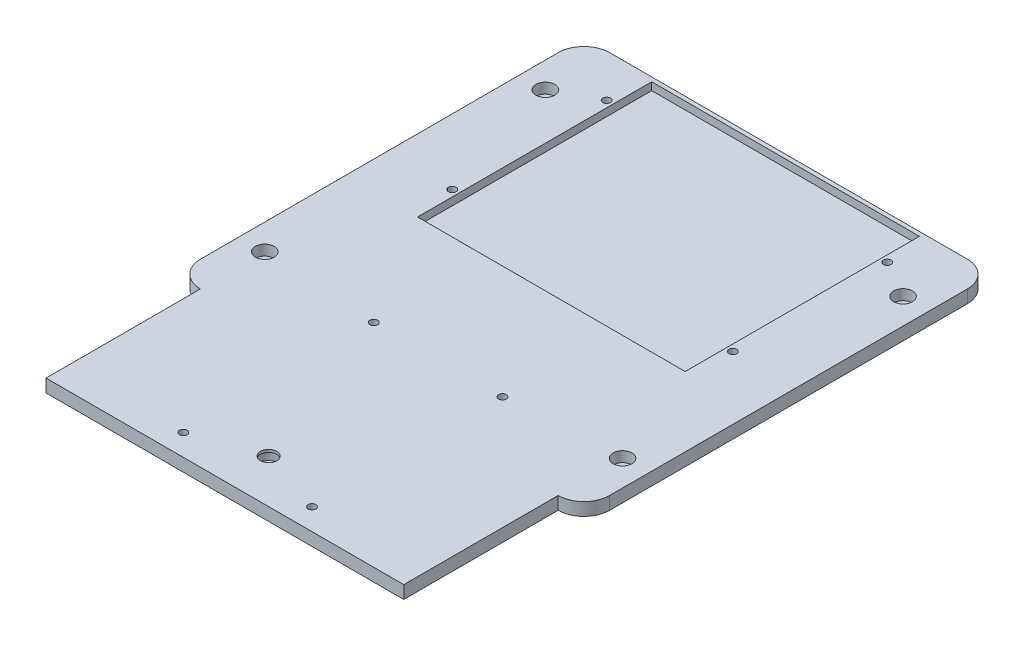
from build123d import *
from build123d.topology import SkipClean

# Parameters (mm, degrees)
SKETCH_1_W               = 159
SKETCH_1_H               = 159
EXTRUDE_1_DEPTH          = 5
SKETCH_2_R               = 2
CUT_EXTRUDE_1_DEPTH      = 5.1
SKETCH_3_R               = 3.65
CUT_EXTRUDE_2_DEPTH      = 4.05
EXTRUDE_3_DEPTH          = 60
SKETCH_6_R               = 3.175
CUT_EXTRUDE_3_DEPTH      = 60
SKETCH_7_R               = 4.9
CUT_EXTRUDE_4_DEPTH      = 4
SKETCH_8_W               = 110.4
SKETCH_8_H               = 88.4
CUT_EXTRUDE_5_DEPTH      = 3
SKETCH_9_R               = 1.5
CUT_EXTRUDE_6_DEPTH      = 10
FILLET_1_R               = 10
FILLET_2_R               = 10
FILLET_3_R               = 10
FILLET_4_R               = 10
SKETCH_11_W              = 49.5
SKETCH_11_H              = 5
EXTRUDE_4_DEPTH          = 60
SKETCH_12_W              = 49.5
SKETCH_12_H              = 5
EXTRUDE_5_DEPTH          = 60
SKETCH_13_R              = 1.5
CUT_EXTRUDE_7_DEPTH      = 5
SKETCH_14_R              = 3
CUT_EXTRUDE_8_DEPTH      = 2.5
SKETCH_16_R              = 1.5
EXTRUDE_6_DEPTH          = 0.5
SKETCH_16_R_2            = 1.448084079
EXTRUDE_6_2_DEPTH        = 0.5
EXTRUDE_6_3_DEPTH        = 0.5
EXTRUDE_6_4_DEPTH        = 0.5
SKETCH_18_W              = 110.4
SKETCH_18_H              = 88.4
EXTRUDE_7_DEPTH          = 3
SKETCH_18_2_W            = 110.4
SKETCH_18_2_H            = 88.4
EXTRUDE_8_DEPTH          = 2
SKETCH_22_W              = 104
SKETCH_22_H              = 91
CUT_EXTRUDE_10_DEPTH     = 3
SKETCH_23_R              = 1.5
CUT_EXTRUDE_11_DEPTH     = 2
CUT_EXTRUDE_12_OUTLINE_R = 1.5
CUT_EXTRUDE_12_DEPTH     = 3


# Read off the part's stored shape, not the designer's step: 切除-拉伸12
with BuildPart() as part:
    # 草图1 → 凸台-拉伸1 (new body)
    with BuildSketch(Plane(origin=(0, 0, 0), x_dir=(1, 0, 0), z_dir=(0, 1, 0))):
        with Locations((-0.471002014, -22.874671738)):
            Rectangle(SKETCH_1_W, SKETCH_1_H)
    extrude(amount=EXTRUDE_1_DEPTH)

    # 草图2 → 切除-拉伸1 (cut)
    with BuildSketch(Plane(origin=(0, 5, 0), x_dir=(1, 0, 0), z_dir=(0, 1, 0))):
        with Locations(Location((-69.971002014, -77.374671738, 0), (0, 0, 270))):
            Circle(SKETCH_2_R)
        with Locations(Location((-69.971002014, 31.625328262, 0), (0, 0, 270))):
            Circle(SKETCH_2_R)
        with Locations(Location((69.028997986, -77.374671738, 0), (0, 0, 270))):
            Circle(SKETCH_2_R)
        with Locations(Location((69.028997986, 31.625328262, 0), (0, 0, 270))):
            Circle(SKETCH_2_R)
    extrude(amount=-CUT_EXTRUDE_1_DEPTH, mode=Mode.SUBTRACT)

    # 草图3 → 切除-拉伸2 (cut)
    with BuildSketch(Plane(origin=(0, 5, 0), x_dir=(1, 0, 0), z_dir=(0, 1, 0))):
        with Locations(Location((-69.971002014, -77.374671738, 0), (0, 0, 270))):
            Circle(SKETCH_3_R)
        with Locations(Location((69.028997986, -77.374671738, 0), (0, 0, 270))):
            Circle(SKETCH_3_R)
        with Locations(Location((69.028997986, 31.625328262, 0), (0, 0, 270))):
            Circle(SKETCH_3_R)
        with Locations(Location((-69.971002014, 31.625328262, 0), (0, 0, 270))):
            Circle(SKETCH_3_R)
    extrude(amount=-CUT_EXTRUDE_2_DEPTH, mode=Mode.SUBTRACT)

    # 草图4 → 凸台-拉伸3 (add)
    with BuildSketch(Plane.XY.offset(102.374671738)):
        Polygon((19.528997986, 5), (-0.471002014, 5), (-20.471002014, 5), (-20.471002014, 0), (19.528997986, 0), align=None)
    extrude(amount=EXTRUDE_3_DEPTH)

    # 草图6 → 切除-拉伸3 (cut)
    with BuildSketch(Plane.XZ):
        with Locations(Location((-0.471002014, 145.374671738, 0), (0, 0, 270))):
            Circle(SKETCH_6_R)
    extrude(amount=-CUT_EXTRUDE_3_DEPTH, mode=Mode.SUBTRACT)

    # 草图7 → 切除-拉伸4 (cut)
    with BuildSketch(Plane(origin=(0, 0, 0), x_dir=(-1, 0, 0), z_dir=(0, -1, 0))):
        with Locations(Location((0.471002014, -145.374671738, 0), (0, 0, 90))):
            Circle(SKETCH_7_R)
    extrude(amount=-CUT_EXTRUDE_4_DEPTH, mode=Mode.SUBTRACT)

    # 草图8 → 切除-拉伸5 (cut)
    with BuildSketch(Plane(origin=(0, 5, 0), x_dir=(1, 0, 0), z_dir=(0, 1, 0))):
        with Locations((-0.471002014, 10.625328262)):
            Rectangle(SKETCH_8_W, SKETCH_8_H)
    extrude(amount=-CUT_EXTRUDE_5_DEPTH, mode=Mode.SUBTRACT)

    # 草图9 → 切除-拉伸6 (cut)
    with BuildSketch(Plane(origin=(0, 2, 0), x_dir=(1, 0, 0), z_dir=(0, 1, 0))):
        with Locations(Location((52.028997986, 52.125328262, 0), (0, 0, 270))):
            Circle(SKETCH_9_R)
        with Locations(Location((52.028997986, -30.874671738, 0), (0, 0, 270))):
            Circle(SKETCH_9_R)
        with Locations(Location((-52.971002014, -30.874671738, 0), (0, 0, 270))):
            Circle(SKETCH_9_R)
        with Locations(Location((-52.971002014, 52.125328262, 0), (0, 0, 270))):
            Circle(SKETCH_9_R)
    extrude(amount=-CUT_EXTRUDE_6_DEPTH, mode=Mode.SUBTRACT)

    # 圆角1
    fillet_1_edges = [part.edges().sort_by_distance(p)[0] for p in [
        (79.028997986, 2.5, -56.625328262),
    ]]
    fillet(fillet_1_edges, radius=FILLET_1_R)

    # 圆角2
    fillet_2_edges = [part.edges().sort_by_distance(p)[0] for p in [
        (-79.971002014, 2.5, -56.625328262),
    ]]
    fillet(fillet_2_edges, radius=FILLET_2_R)

    # 圆角3
    fillet_3_edges = [part.edges().sort_by_distance(p)[0] for p in [
        (-79.971002014, 2.5, 102.374671738),
    ]]
    fillet(fillet_3_edges, radius=FILLET_3_R)

    # 圆角4
    fillet_4_edges = [part.edges().sort_by_distance(p)[0] for p in [
        (79.028997986, 2.5, 102.374671738),
    ]]
    fillet(fillet_4_edges, radius=FILLET_4_R)

    # 草图11 → 凸台-拉伸4 (add)
    with BuildSketch(Plane.XY.offset(102.374671738)):
        with Locations((-45.221002014, 2.5)):
            Rectangle(SKETCH_11_W, SKETCH_11_H)
    extrude(amount=EXTRUDE_4_DEPTH)

    # 草图12 → 凸台-拉伸5 (add)
    with BuildSketch(Plane.XY.offset(102.374671738)):
        with Locations((44.278997986, 2.5)):
            Rectangle(SKETCH_12_W, SKETCH_12_H)
    extrude(amount=EXTRUDE_5_DEPTH)

    # 草图13 → 切除-拉伸7 (cut)
    with BuildSketch(Plane(origin=(0, 5, 0), x_dir=(1, 0, 0), z_dir=(0, 1, 0))):
        with Locations(Location((-25, -80, 0), (0, 0, 270))):
            Circle(SKETCH_13_R)
        with Locations(Location((-25, -154, 0), (0, 0, 270))):
            Circle(SKETCH_13_R)
        with Locations(Location((25, -80, 0), (0, 0, 270))):
            Circle(SKETCH_13_R)
        with Locations(Location((25, -154, 0), (0, 0, 270))):
            Circle(SKETCH_13_R)
    extrude(amount=-CUT_EXTRUDE_7_DEPTH, mode=Mode.SUBTRACT)

    # 草图14 → 切除-拉伸8 (cut)
    with BuildSketch(Plane.XZ):
        with Locations(Location((-25, 80, 0), (0, 0, 270))):
            Circle(SKETCH_14_R)
        with Locations(Location((-25, 154, 0), (0, 0, 270))):
            Circle(SKETCH_14_R)
        with Locations(Location((25, 154, 0), (0, 0, 270))):
            Circle(SKETCH_14_R)
        with Locations(Location((25, 80, 0), (0, 0, 270))):
            Circle(SKETCH_14_R)
    extrude(amount=-CUT_EXTRUDE_8_DEPTH, mode=Mode.SUBTRACT)



with BuildPart() as body_2:
    # 草图16 → 凸台-拉伸6 (new body)
    with BuildSketch(Plane(origin=(0, 2, 0), x_dir=(1, 0, 0), z_dir=(0, 1, 0))):
        with Locations(Location((-52.971002014, 52.125328262, 0), (0, 0, 270))):
            Circle(SKETCH_16_R)
    extrude(amount=EXTRUDE_6_DEPTH)


with BuildPart() as body_3:
    # 草图16 → Extrude 6 2 (new body)
    with BuildSketch(Plane(origin=(0, 2, 0), x_dir=(1, 0, 0), z_dir=(0, 1, 0))):
        with Locations(Location((52.028997986, 52.125328262, 0), (0, 0, 270))):
            Circle(SKETCH_16_R_2)
    extrude(amount=EXTRUDE_6_2_DEPTH)


with BuildPart() as body_4:
    # 草图16 → Extrude 6 3 (new body)
    with BuildSketch(Plane(origin=(0, 2, 0), x_dir=(1, 0, 0), z_dir=(0, 1, 0))):
        with Locations(Location((-52.971002014, -30.874671738, 0), (0, 0, 270))):
            Circle(SKETCH_16_R)
    extrude(amount=EXTRUDE_6_3_DEPTH)


with BuildPart() as body_5:
    # 草图16 → Extrude 6 4 (new body)
    with BuildSketch(Plane(origin=(0, 2, 0), x_dir=(1, 0, 0), z_dir=(0, 1, 0))):
        with Locations(Location((52.028997986, -30.874671738, 0), (0, 0, 270))):
            Circle(SKETCH_16_R)
    extrude(amount=EXTRUDE_6_4_DEPTH)


with BuildPart() as part_1:
    add(part.part)

    add(body_2.part)  # 凸台-拉伸7 merges body 2

    add(body_3.part)  # 凸台-拉伸7 merges body 3

    add(body_4.part)  # 凸台-拉伸7 merges body 4

    add(body_5.part)  # 凸台-拉伸7 merges body 5
    # 草图18 → 凸台-拉伸7 (add)
    with BuildSketch(Plane(origin=(0, 2, 0), x_dir=(1, 0, 0), z_dir=(0, 1, 0))):
        with Locations((-0.471002014, 10.625328262)):
            Rectangle(SKETCH_18_W, SKETCH_18_H)
    extrude(amount=EXTRUDE_7_DEPTH)

    # 草图18<2> → 凸台-拉伸8 (add)
    with BuildSketch(Plane(origin=(0, 2, 0), x_dir=(1, 0, 0), z_dir=(0, 1, 0))):
        with Locations((-0.471002014, 10.625328262)):
            Rectangle(SKETCH_18_2_W, SKETCH_18_2_H)
    extrude(amount=-EXTRUDE_8_DEPTH)

    # 草图22 → 切除-拉伸10 (cut)
    with BuildSketch(Plane(origin=(0, 5, 0), x_dir=(1, 0, 0), z_dir=(0, 1, 0))):
        with Locations((0, 9.5)):
            Rectangle(SKETCH_22_W, SKETCH_22_H)
    extrude(amount=-CUT_EXTRUDE_10_DEPTH, mode=Mode.SUBTRACT)

    # 草图23 → 切除-拉伸11 (cut)
    with BuildSketch(Plane(origin=(0, 5, 0), x_dir=(1, 0, 0), z_dir=(0, 1, 0))):
        with Locations(Location((-54.5, 40, 0), (0, 0, 270))):
            Circle(SKETCH_23_R)
        with Locations(Location((54.5, 40, 0), (0, 0, 270))):
            Circle(SKETCH_23_R)
        with Locations(Location((-54.5, -20, 0), (0, 0, 270))):
            Circle(SKETCH_23_R)
        with Locations(Location((54.5, -20, 0), (0, 0, 270))):
            Circle(SKETCH_23_R)
    extrude(amount=-CUT_EXTRUDE_11_DEPTH, mode=Mode.SUBTRACT)

    # 切除-拉伸12 outline → 切除-拉伸12 (cut)
    with SkipClean():  # the faces are left unmerged after this step: merging them gives an invalid solid
        with BuildSketch(Plane(origin=(0, 0, 0), x_dir=(1, 0, 0), z_dir=(0, 1, 0))):
            with Locations((-54.5, 40)):
                Circle(CUT_EXTRUDE_12_OUTLINE_R)
            with Locations((54.5, -20)):
                Circle(CUT_EXTRUDE_12_OUTLINE_R)
            with Locations((-54.5, -20)):
                Circle(CUT_EXTRUDE_12_OUTLINE_R)
            with Locations((54.5, 40)):
                Circle(CUT_EXTRUDE_12_OUTLINE_R)
        extrude(amount=CUT_EXTRUDE_12_DEPTH, mode=Mode.SUBTRACT)


solid = part_1.part
